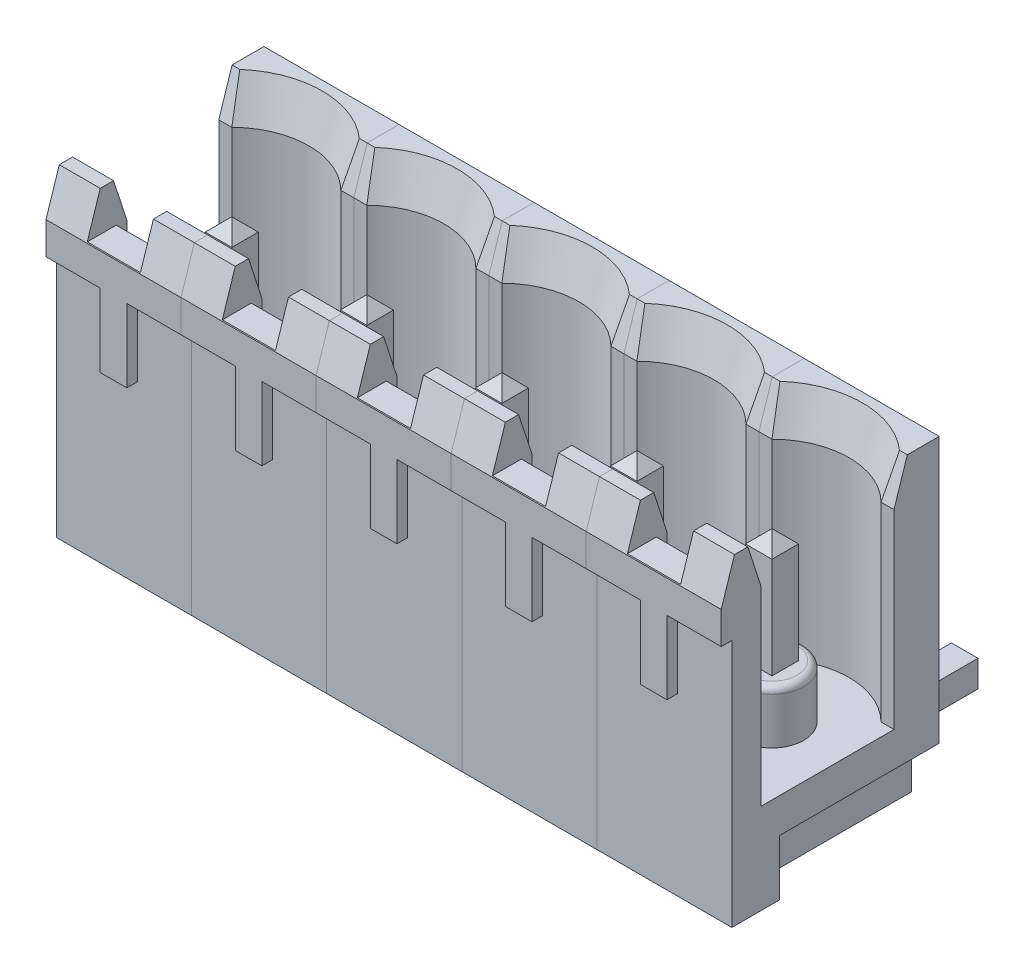
from build123d import *
from OCP.BRepFilletAPI import BRepFilletAPI_MakeChamfer

# Parameters (mm, degrees)
SKETCH_1_W             = 5.08
SKETCH_1_H             = 12.1
EXTRUDE_1_DEPTH        = 8.2
CUT_EXTRUDE_1_DEPTH    = 8.7
SKETCH_3_R             = 1.2
EXTRUDE_2_DEPTH        = 2
FILLET_1_R             = 0.25
CHAMFER_1_SIZE         = 0.5
CHAMFER_1_SIZE2        = 1.538841769
SKETCH_4_W             = 2
SKETCH_4_H             = 1.010953213
CUT_EXTRUDE_2_DEPTH    = 4.75
SKETCH_5_W             = 2
SKETCH_5_H             = 1.705458635
CUT_EXTRUDE_3_DEPTH    = 1.5
CHAMFER_2_SIZE         = 0.5
CHAMFER_2_SIZE2        = 1.538841769
SKETCH_6_W             = 5.08
SKETCH_6_H             = 6.6
CUT_EXTRUDE_4_DEPTH    = 0.4
SKETCH_7_W             = 2.04
SKETCH_7_H             = 2.75
CUT_EXTRUDE_5_DEPTH    = 0.4
EXTRUDE_1_2_DEPTH      = 0.5
EXTRUDE_1_2_DEPTH_BACK = 0.5
CHAMFER_3_SIZE         = 0.5
SKETCH_9_W             = 1
SKETCH_9_H             = 2.1
SKETCH_9_W_2           = 1.04
CUT_EXTRUDE_6_DEPTH    = 6
PATTERN_LINEAR_1_COUNT = 5
PATTERN_LINEAR_1_PITCH = 5.08
MOVE_BODY_1_ANGLE      = 180


with BuildPart() as part:
    # Эскиз1 → Extrude 1 (new body)
    with BuildSketch(Plane(origin=(0, 0, 0), x_dir=(1, 0, 0), z_dir=(0, 1, 0))):
        Rectangle(SKETCH_1_W, SKETCH_1_H)
    extrude(amount=EXTRUDE_1_DEPTH)

    # Эскиз2 → Вырез-Вытянуть1 (cut)
    with BuildSketch(Plane.XY.offset(6.05)):
        with BuildLine():
            Line((-2.54, 6.7), (2.54, 6.7))
            Line((2.54, 6.7), (2.54, 1.7))
            Line((2.54, 1.7), (2.05121915, 1.7))
            ThreePointArc((2.05121915, 1.7), (0, 0.85), (-2.05121915, 1.7))
            Line((-2.05121915, 1.7), (-2.54, 1.7))
            Line((-2.54, 1.7), (-2.54, 6.7))
        make_face()
    extrude(amount=-CUT_EXTRUDE_1_DEPTH, mode=Mode.SUBTRACT)

    # Эскиз3 → Бобышка-Вытянуть2 (add)
    with BuildSketch(Plane.XY.offset(-2.65)):
        with Locations((0, 3.75)):
            Circle(SKETCH_3_R)
    extrude(amount=EXTRUDE_2_DEPTH)

    # Скругление1
    fillet_1_edges = [part.edges().sort_by_distance(p)[0] for p in [
        (-1.2, 3.75, -0.65),
    ]]
    fillet(fillet_1_edges, radius=FILLET_1_R)

    # Фаска1: one chamfer whose edges measure the first distance from different faces: ONE call of the kernel's chamfer builder (chamfer() names one face for all edges)
    chamfer_1_edges_1 = [part.edges().sort_by_distance(p)[0] for p in [
        (0, 6.7, 6.05),
    ]]
    chamfer_1_side_1 = [part.faces().sort_by_distance(p)[0] for p in [
        (0, 7.45, 6.05),
    ]]
    chamfer_1_edges_2 = [part.edges().sort_by_distance(p)[0] for p in [
        (2.295609575, 1.7, 6.05),
        (-2.295609575, 1.7, 6.05),
        (0, 0.85, 6.05),
    ]]
    chamfer_1_side_2 = [part.faces().sort_by_distance(p)[0] for p in [
        (0, 0.655214235, 6.05),
    ]]
    chamfer_1 = BRepFilletAPI_MakeChamfer(part.part.solid().wrapped)
    for e in chamfer_1_edges_1:
        chamfer_1.Add(CHAMFER_1_SIZE, CHAMFER_1_SIZE2, e.wrapped, chamfer_1_side_1[0].wrapped)  # the first distance lies on this face
    for e in chamfer_1_edges_2:
        chamfer_1.Add(CHAMFER_1_SIZE, CHAMFER_1_SIZE2, e.wrapped, chamfer_1_side_2[0].wrapped)  # the first distance lies on this face
    add(Compound.cast(chamfer_1.Shape()), mode=Mode.REPLACE)

    # Эскиз4 → Вырез-Вытянуть2 (cut)
    with BuildSketch(Plane.XY.offset(6.05)):
        with Locations((0, 6.594523394)):
            Rectangle(SKETCH_4_W, SKETCH_4_H)
    extrude(amount=-CUT_EXTRUDE_2_DEPTH, mode=Mode.SUBTRACT)

    # Эскиз5 → Вырез-Вытянуть3 (cut)
    with BuildSketch(Plane.XY.offset(6.05)):
        with Locations((0, 7.552729318)):
            Rectangle(SKETCH_5_W, SKETCH_5_H)
    extrude(amount=-CUT_EXTRUDE_3_DEPTH, mode=Mode.SUBTRACT)

    # Фаска2
    chamfer_2_edges = [part.edges().sort_by_distance(p)[0] for p in [
        (-1.77, 8.2, 6.05),
    ]]
    chamfer_2_side = [part.faces().sort_by_distance(p)[0] for p in [
        (-1.77, 7.7, 6.05),
    ]]
    chamfer(chamfer_2_edges, length=CHAMFER_2_SIZE, length2=CHAMFER_2_SIZE2, reference=chamfer_2_side[0])

    # Эскиз6 → Вырез-Вытянуть4 (cut)
    with BuildSketch(Plane(origin=(0, 8.2, 0), x_dir=(1, 0, 0), z_dir=(0, 1, 0))):
        with Locations((0, 2.75)):
            Rectangle(SKETCH_6_W, SKETCH_6_H)
    extrude(amount=-CUT_EXTRUDE_4_DEPTH, mode=Mode.SUBTRACT)

    # Эскиз7 → Вырез-Вытянуть5 (cut)
    with BuildSketch(Plane(origin=(0, 8.2, 0), x_dir=(1, 0, 0), z_dir=(0, 1, 0))):
        with Locations((1.52, -1.925)):
            Rectangle(SKETCH_7_W, SKETCH_7_H)
        with Locations((-1.52, -1.925)):
            Rectangle(SKETCH_7_W, SKETCH_7_H)
    extrude(amount=-CUT_EXTRUDE_5_DEPTH, mode=Mode.SUBTRACT)

    # Эскиз9 → Вырез-Вытянуть6 (cut)
    with BuildSketch(Plane.XZ):
        with Locations((0, -5)):
            Rectangle(SKETCH_9_W, SKETCH_9_H)
        with Locations((-2.02, -5)):
            Rectangle(SKETCH_9_W_2, SKETCH_9_H)
        with Locations((2.02, -5)):
            Rectangle(SKETCH_9_W_2, SKETCH_9_H)
    extrude(amount=-CUT_EXTRUDE_6_DEPTH, mode=Mode.SUBTRACT)


with BuildPart() as body_2:
    # Эскиз8 → Extrude 1 2 (new, two sides: drawn at the far end of the back side and taken through both)
    with BuildSketch(Plane(origin=(0, 0, 0), x_dir=(0, 0, -1), z_dir=(1, 0, 0)).offset(-EXTRUDE_1_2_DEPTH_BACK)):
        with BuildLine():
            Line((-3.65, 3.25), (3.95, 3.25))
            Line((3.95, 3.25), (3.95, -4))
            Line((3.95, -4), (4.95, -4))
            Line((4.95, -4), (4.95, 3.25))
            ThreePointArc((4.95, 3.25), (4.657106781, 3.957106781), (3.95, 4.25))
            Line((3.95, 4.25), (-3.65, 4.25))
            Line((-3.65, 4.25), (-3.65, 3.25))
        make_face()
    extrude(amount=EXTRUDE_1_2_DEPTH + EXTRUDE_1_2_DEPTH_BACK)

    # Фаска3
    chamfer_3_edges = [body_2.edges().sort_by_distance(p)[0] for p in [
        (0, 3.25, 3.65),
        (0, 4.25, 3.65),
        (0, -4, -4.95),
        (0, -4, -3.95),
        (0.5, -4, -4.45),
        (0.5, 3.75, 3.65),
        (-0.5, 3.75, 3.65),
        (-0.5, -4, -4.45),
    ]]
    chamfer(chamfer_3_edges, length=CHAMFER_3_SIZE - 0.0001)  # a hair under: the kernel refuses the full size


with BuildPart() as pattern_linear_1_1:
    # Линейный массив1: pattern copy
    add(part.part.moved(Location(Vector(-1, 0, 0) * (1 * PATTERN_LINEAR_1_PITCH))))


with BuildPart() as pattern_linear_1_2:
    # Линейный массив1: pattern copy
    add(part.part.moved(Location(Vector(-1, 0, 0) * (2 * PATTERN_LINEAR_1_PITCH))))


with BuildPart() as pattern_linear_1_3:
    # Линейный массив1: pattern copy
    add(part.part.moved(Location(Vector(-1, 0, 0) * (3 * PATTERN_LINEAR_1_PITCH))))


with BuildPart() as pattern_linear_1_4:
    # Линейный массив1: pattern copy
    add(part.part.moved(Location(Vector(-1, 0, 0) * (4 * PATTERN_LINEAR_1_PITCH))))


with BuildPart() as pattern_linear_1_5:
    # Линейный массив1: pattern copy
    add(body_2.part.moved(Location(Vector(-1, 0, 0) * (1 * PATTERN_LINEAR_1_PITCH))))


with BuildPart() as pattern_linear_1_6:
    # Линейный массив1: pattern copy
    add(body_2.part.moved(Location(Vector(-1, 0, 0) * (2 * PATTERN_LINEAR_1_PITCH))))


with BuildPart() as pattern_linear_1_7:
    # Линейный массив1: pattern copy
    add(body_2.part.moved(Location(Vector(-1, 0, 0) * (3 * PATTERN_LINEAR_1_PITCH))))


with BuildPart() as pattern_linear_1_8:
    # Линейный массив1: pattern copy
    add(body_2.part.moved(Location(Vector(-1, 0, 0) * (4 * PATTERN_LINEAR_1_PITCH))))


with BuildPart() as body_2_1:
    # Move Body 1: moved
    add(body_2.part.rotate(Axis((0, 0, 0), (0, 0.7071067811865488, 0.7071067811865462)), MOVE_BODY_1_ANGLE))


with BuildPart() as part_1:
    # Move Body 1: moved
    add(part.part.rotate(Axis((0, 0, 0), (0, 0.7071067811865488, 0.7071067811865462)), MOVE_BODY_1_ANGLE))


with BuildPart() as pattern_linear_1_5_1:
    # Move Body 1: moved
    add(pattern_linear_1_5.part.rotate(Axis((0, 0, 0), (0, 0.7071067811865488, 0.7071067811865462)), MOVE_BODY_1_ANGLE))


with BuildPart() as pattern_linear_1_1_1:
    # Move Body 1: moved
    add(pattern_linear_1_1.part.rotate(Axis((0, 0, 0), (0, 0.7071067811865488, 0.7071067811865462)), MOVE_BODY_1_ANGLE))


with BuildPart() as pattern_linear_1_2_1:
    # Move Body 1: moved
    add(pattern_linear_1_2.part.rotate(Axis((0, 0, 0), (0, 0.7071067811865488, 0.7071067811865462)), MOVE_BODY_1_ANGLE))


with BuildPart() as pattern_linear_1_6_1:
    # Move Body 1: moved
    add(pattern_linear_1_6.part.rotate(Axis((0, 0, 0), (0, 0.7071067811865488, 0.7071067811865462)), MOVE_BODY_1_ANGLE))


with BuildPart() as pattern_linear_1_3_1:
    # Move Body 1: moved
    add(pattern_linear_1_3.part.rotate(Axis((0, 0, 0), (0, 0.7071067811865488, 0.7071067811865462)), MOVE_BODY_1_ANGLE))


with BuildPart() as pattern_linear_1_4_1:
    # Move Body 1: moved
    add(pattern_linear_1_4.part.rotate(Axis((0, 0, 0), (0, 0.7071067811865488, 0.7071067811865462)), MOVE_BODY_1_ANGLE))


with BuildPart() as pattern_linear_1_8_1:
    # Move Body 1: moved
    add(pattern_linear_1_8.part.rotate(Axis((0, 0, 0), (0, 0.7071067811865488, 0.7071067811865462)), MOVE_BODY_1_ANGLE))


with BuildPart() as pattern_linear_1_7_1:
    # Move Body 1: moved
    add(pattern_linear_1_7.part.rotate(Axis((0, 0, 0), (0, 0.7071067811865488, 0.7071067811865462)), MOVE_BODY_1_ANGLE))


with BuildPart() as pattern_linear_1_7_2:
    # Move Body 2: read off the stored shape, not the designer's step
    # Move Body 2: moved
    add(pattern_linear_1_7_1.part.moved(Location((0, 4.45, 0))))


with BuildPart() as pattern_linear_1_8_2:
    # Move Body 2 2: moved
    add(pattern_linear_1_8_1.part.moved(Location((0, 4.45, 0))))


with BuildPart() as pattern_linear_1_4_2:
    # Move Body 2 3: moved
    add(pattern_linear_1_4_1.part.moved(Location((0, 4.45, 0))))


with BuildPart() as pattern_linear_1_3_2:
    # Move Body 2 4: moved
    add(pattern_linear_1_3_1.part.moved(Location((0, 4.45, 0))))


with BuildPart() as pattern_linear_1_6_2:
    # Move Body 2 5: moved
    add(pattern_linear_1_6_1.part.moved(Location((0, 4.45, 0))))


with BuildPart() as pattern_linear_1_2_2:
    # Move Body 2 6: moved
    add(pattern_linear_1_2_1.part.moved(Location((0, 4.45, 0))))


with BuildPart() as pattern_linear_1_1_2:
    # Move Body 2 7: moved
    add(pattern_linear_1_1_1.part.moved(Location((0, 4.45, 0))))


with BuildPart() as pattern_linear_1_5_2:
    # Move Body 2 8: moved
    add(pattern_linear_1_5_1.part.moved(Location((0, 4.45, 0))))


with BuildPart() as part_2:
    # Move Body 2 9: moved
    add(part_1.part.moved(Location((0, 4.45, 0))))


with BuildPart() as body_2_2:
    # Move Body 2 10: moved
    add(body_2_1.part.moved(Location((0, 4.45, 0))))


solid = Compound([pattern_linear_1_7_2.part, pattern_linear_1_8_2.part, pattern_linear_1_4_2.part, pattern_linear_1_3_2.part, pattern_linear_1_6_2.part, pattern_linear_1_2_2.part, pattern_linear_1_1_2.part, pattern_linear_1_5_2.part, part_2.part, body_2_2.part])
